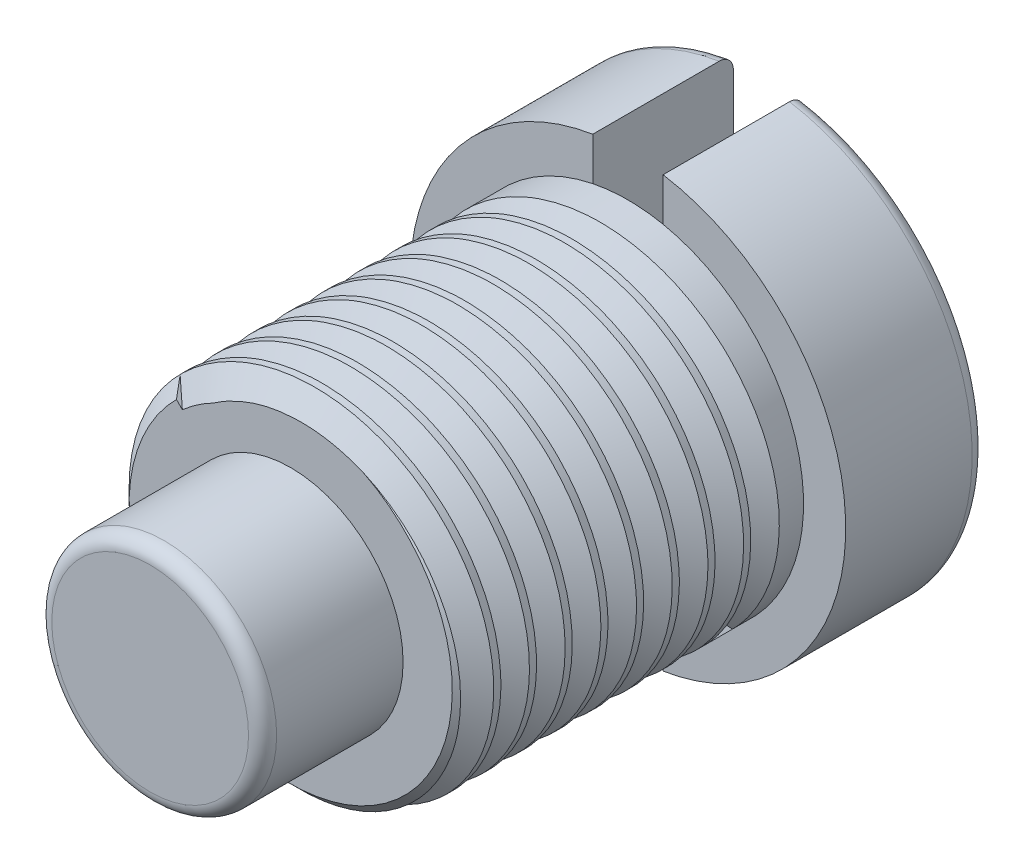
from build123d import *

# Parameters (mm, degrees)
SKETCH1_R           = 6.25
BOSS_EXTRUDE1_DEPTH = 12
SKETCH2_R           = 7.75
BOSS_EXTRUDE2_DEPTH = 5
FILLET1_R           = 0.5
CUT_EXTRUDE1_DEPTH  = 5
CHAMFER1_SIZE       = 0.5
CUT_SWEEP1_PITCH    = 1.27
SKETCH7_R           = 4
CUT_EXTRUDE2_DEPTH  = 10
SKETCH8_R           = 4
BOSS_EXTRUDE3_DEPTH = 15
FILLET2_R           = 0.5


with BuildPart() as part:
    # Sketch1 → Boss-Extrude1 (new body)
    with BuildSketch(Plane.XY):
        Circle(SKETCH1_R)
    extrude(amount=BOSS_EXTRUDE1_DEPTH)

    # Sketch2 → Boss-Extrude2 (add)
    with BuildSketch(Plane(origin=(0, 0, 0), x_dir=(-1, 0, 0), z_dir=(0, 0, -1))):
        Circle(SKETCH2_R)
    extrude(amount=BOSS_EXTRUDE2_DEPTH)

    # Fillet1
    fillet1_edges = [part.edges().sort_by_distance(p)[0] for p in [
        (7.75, 0, -5),
    ]]
    fillet(fillet1_edges, radius=FILLET1_R)

    # Sketch3 → Cut-Extrude1 (cut)
    with BuildSketch(Plane(origin=(0, 0, -5), x_dir=(-1, 0, 0), z_dir=(0, 0, -1))):
        with BuildLine():
            Line((0, -7.25), (0, 7.25))
            ThreePointArc((0, 7.25), (-0.627353127, 7.222806107), (-1.25, 7.141428429))
            Line((-1.25, 7.141428429), (-1.25, -7.141428429))
            ThreePointArc((-1.25, -7.141428429), (-0.627353127, -7.222806107), (0, -7.25))
        make_face()
        with BuildLine():
            ThreePointArc((1.25, 7.141428429), (0.627353127, 7.222806107), (0, 7.25))
            Line((0, 7.25), (0, -7.25))
            ThreePointArc((0, -7.25), (0.627353127, -7.222806107), (1.25, -7.141428429))
            Line((1.25, -7.141428429), (1.25, 7.141428429))
        make_face()
        with BuildLine():
            ThreePointArc((1.25, -7.141428429), (0.627353127, -7.222806107), (0, -7.25))
            Line((0, -7.25), (0, -9.29273834))
            Line((0, -9.29273834), (1.25, -9.29273834))
            Line((1.25, -9.29273834), (1.25, -7.141428429))
        make_face()
        with BuildLine():
            Line((0, -9.29273834), (0, -7.25))
            ThreePointArc((0, -7.25), (-0.627353127, -7.222806107), (-1.25, -7.141428429))
            Line((-1.25, -7.141428429), (-1.25, -9.29273834))
            Line((-1.25, -9.29273834), (0, -9.29273834))
        make_face()
        with BuildLine():
            Line((1.25, 9.101690424), (0, 9.101690424))
            Line((0, 9.101690424), (0, 7.25))
            ThreePointArc((0, 7.25), (0.627353127, 7.222806107), (1.25, 7.141428429))
            Line((1.25, 7.141428429), (1.25, 9.101690424))
        make_face()
        with BuildLine():
            Line((0, 7.25), (0, 9.101690424))
            Line((0, 9.101690424), (-1.25, 9.101690424))
            Line((-1.25, 9.101690424), (-1.25, 7.141428429))
            ThreePointArc((-1.25, 7.141428429), (-0.627353127, 7.222806107), (0, 7.25))
        make_face()
    extrude(amount=-CUT_EXTRUDE1_DEPTH, mode=Mode.SUBTRACT)

    # Chamfer1
    chamfer1_edges = [part.edges().sort_by_distance(p)[0] for p in [
        (-6.25, 0, 12),
    ]]
    chamfer(chamfer1_edges, length=CHAMFER1_SIZE)

    # Cut-Sweep1: the profile of Sketch6 screwed along a right-hand helix of 8.5 turns, 8 arcs to a turn; built about Z, then put on its axis
    cut_sweep1_z = Axis((0, 0, 0), (0, 0, 1))
    cut_sweep1_corners = [(6.48147091, 0.02082953, -0.6440738), (5.370495391, 0.00161591, -0.049965869), (6.440764704, -0.019876676, 0.614610437)]
    with BuildLine(mode=Mode.PRIVATE) as cut_sweep1_profile:
        Line(cut_sweep1_corners[0], cut_sweep1_corners[1])
        Line(cut_sweep1_corners[1], cut_sweep1_corners[2])
        Line(cut_sweep1_corners[2], cut_sweep1_corners[0])
    cut_sweep1_cap = Face(cut_sweep1_profile.wire())
    cut_sweep1_turn_angles = [0, 22.5, 45, 67.5, 90, 112.5, 135, 157.5, 180, 202.5, 225, 247.5, 270, 292.5, 315, 337.5, 360]
    cut_sweep1_turn_weights = [1, 0.9238795325112867, 1, 0.9238795325112867, 1, 0.9238795325112867, 1, 0.9238795325112867, 1, 0.9238795325112867, 1, 0.9238795325112867, 1, 0.9238795325112867, 1, 0.9238795325112867, 1]
    cut_sweep1_turn_rails = [Edge.make_bspline([Vector(p[0], p[1], 0).rotate(cut_sweep1_z, cut_sweep1_turn_angles[k]) / cut_sweep1_turn_weights[k] + Vector(0, 0, p[2] + CUT_SWEEP1_PITCH * cut_sweep1_turn_angles[k] / 360) for k in range(17)], [0, 0, 0, 1, 1, 2, 2, 3, 3, 4, 4, 5, 5, 6, 6, 7, 7, 8, 8, 8], 2, cut_sweep1_turn_weights) for p in cut_sweep1_corners]
    cut_sweep1_turn_sides = [Face.make_surface_from_curves(cut_sweep1_turn_rails[p[0]], cut_sweep1_turn_rails[p[1]]) for p in [(0, 1), (1, 2), (2, 0)]]
    cut_sweep1_last_angles = [2880, 2902.5, 2925, 2947.5, 2970, 2992.5, 3015, 3037.5, 3060]
    cut_sweep1_last_weights = [1, 0.9238795325112867, 1, 0.9238795325112867, 1, 0.9238795325112867, 1, 0.9238795325113035, 1]
    cut_sweep1_last_rails = [Edge.make_bspline([Vector(p[0], p[1], 0).rotate(cut_sweep1_z, cut_sweep1_last_angles[k]) / cut_sweep1_last_weights[k] + Vector(0, 0, p[2] + CUT_SWEEP1_PITCH * cut_sweep1_last_angles[k] / 360) for k in range(9)], [0, 0, 0, 1, 1, 2, 2, 3, 3, 4, 4, 4], 2, cut_sweep1_last_weights) for p in cut_sweep1_corners]
    cut_sweep1_last_sides = [Face.make_surface_from_curves(cut_sweep1_last_rails[p[0]], cut_sweep1_last_rails[p[1]]) for p in [(0, 1), (1, 2), (2, 0)]]
    cut_sweep1 = Plane(origin=(0, 0, 12), x_dir=(-0.7071067811865513, 0.7071067811865438, 0), z_dir=(0, 0, -1)) * Solid(Shell([*[p.moved(Location((0, 0, CUT_SWEEP1_PITCH * i))) for i in range(8) for p in cut_sweep1_turn_sides], *cut_sweep1_last_sides, cut_sweep1_cap, cut_sweep1_cap.rotate(cut_sweep1_z, 3060).moved(Location((0, 0, CUT_SWEEP1_PITCH * 3060 / 360)))]))
    add(cut_sweep1, mode=Mode.SUBTRACT)

    # Sketch7 → Cut-Extrude2 (cut)
    with BuildSketch(Plane.XY.offset(12)):
        Circle(SKETCH7_R)
    extrude(amount=-CUT_EXTRUDE2_DEPTH, mode=Mode.SUBTRACT)


with BuildPart() as body_2:
    # Sketch8 → Boss-Extrude3 (new body)
    with BuildSketch(Plane.XY.offset(2)):
        Circle(SKETCH8_R)
    extrude(amount=BOSS_EXTRUDE3_DEPTH)

    # Fillet2
    fillet2_edges = [body_2.edges().sort_by_distance(p)[0] for p in [
        (-4, 0, 17),
    ]]
    fillet(fillet2_edges, radius=FILLET2_R)


solid = Compound([part.part, body_2.part])
